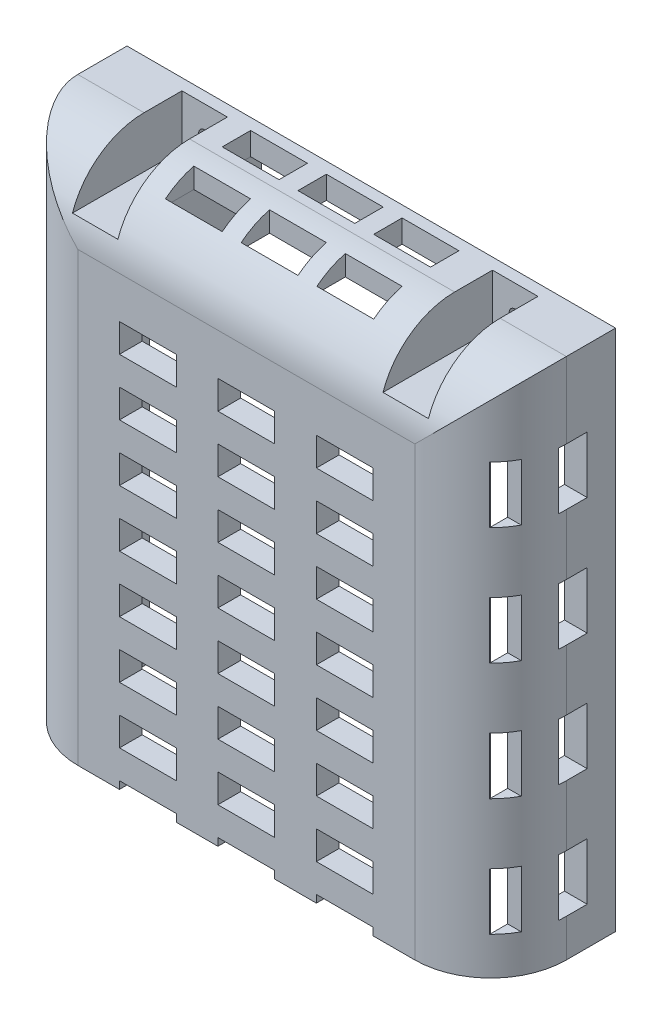
from build123d import *

# Parameters (mm, degrees)
ESBO_O1_W                = 129
ESBO_O1_H                = 276
ESBO_O1_R                = 1.6
RESSALTO_EXTRUS_O1_DEPTH = 3
ESBO_O4_W                = 70
ESBO_O4_H                = 6
ESBO_O4_W_2              = 6
ESBO_O4_H_2              = 100
RESSALTO_EXTRUS_O2_DEPTH = 24
RESSALTO_EXTRUS_O3_DEPTH = 6
RESSALTO_EXTRUS_O5_DEPTH = 27
RESSALTO_EXTRUS_O6_DEPTH = 94
FILETE1_R                = 20
ESBO_O9_R                = 5
ESBO_O9_W                = 15
ESBO_O9_H                = 7.5
CORTE_EXTRUS_O1_DEPTH    = 6
ESBO_O10_W               = 15
ESBO_O10_H               = 7.5
CORTE_EXTRUS_O2_DEPTH    = 6
ESBO_O11_W               = 15
ESBO_O11_H               = 7.5
CORTE_EXTRUS_O3_DEPTH    = 6
ESBO_O12_W               = 7.5
ESBO_O12_H               = 15
CORTE_EXTRUS_O4_DEPTH    = 6
CORTE_EXTRUS_O5_START    = -33
ESBO_O13_W               = 129
ESBO_O13_H               = 149.471958757
CORTE_EXTRUS_O5_DEPTH    = 33


with BuildPart() as part:
    # Esboço1 → Ressalto-extrusão1 (new body)
    with BuildSketch(Plane.XY):
        Rectangle(ESBO_O1_W, ESBO_O1_H)
        with Locations((-53.125, -128)):
            Circle(ESBO_O1_R, mode=Mode.SUBTRACT)
        with Locations((-41, 130.5)):
            Circle(ESBO_O1_R, mode=Mode.SUBTRACT)
        with Locations(Location((41, 130.5, 0), (0, 0, 180))):
            Circle(ESBO_O1_R, mode=Mode.SUBTRACT)
        with Locations(Location((53.125, -128, 0), (0, 0, 180))):
            Circle(ESBO_O1_R, mode=Mode.SUBTRACT)
        Polygon((-47.125, -132), (-47.125, -122), (-58.5, -122), (-58.5, 132), (-47, 132), (-47, 124.5), (-35, 124.5), (-35, 132), (35, 132), (35, 124.5), (47, 124.5), (47, 132), (58.5, 132), (58.5, -122), (47.125, -122), (47.125, -132), align=None, mode=Mode.SUBTRACT)
    extrude(amount=RESSALTO_EXTRUS_O1_DEPTH)

    # Esboço4 → Ressalto-extrusão2 (add)
    with BuildSketch(Plane.XY.offset(3)):
        Polygon((-64.5, 138), (-64.5, 72), (-58.5, 72), (-58.5, 132), (-47, 132), (-47, 138), align=None)
        with Locations((0, 135)):
            Rectangle(ESBO_O4_W, ESBO_O4_H)
        Polygon((47, 132), (47, 138), (64.5, 138), (64.5, 72), (58.5, 72), (58.5, 132), align=None)
        Polygon((-47.125, -132), (-47.125, -138), (47, -138), (47.125, -132), align=None)
        with Locations((-61.5, -72)):
            Rectangle(ESBO_O4_W_2, ESBO_O4_H_2)
        with Locations((61.5, -72)):
            Rectangle(ESBO_O4_W_2, ESBO_O4_H_2)
    extrude(amount=RESSALTO_EXTRUS_O2_DEPTH)

    # Esboço5 → Ressalto-extrusão3 (add)
    with BuildSketch(Plane.XY.offset(27)):
        Polygon((-35, 132), (-35, 138), (35, 138), (35, 132), (35, 124.5), (47, 124.5), (47, 132), (47, 138), (64.5, 138), (64.5, 72), (58.5, 72), (-64.5, 72), (-64.5, 138), (-47, 138), (-47, 124.5), (-35, 124.5), align=None)
        Polygon((-47.125, -138), (47, -138), (47.125, -122), (64.5, -122), (64.5, -22), (-64.5, -22), (-64.5, -122), (-47.125, -122), align=None)
    extrude(amount=RESSALTO_EXTRUS_O3_DEPTH)

    # Esboço7 → Ressalto-extrusão5 (add)
    with BuildSketch(Plane(origin=(0, 0, 27), x_dir=(-1, 0, 0), z_dir=(0, 0, -1))):
        Polygon((-47, 132), (-53, 132), (-53, 118.5), (-29, 118.5), (-29, 132), (-35, 132), (-35, 124.5), (-47, 124.5), align=None)
        Polygon((47.125, -132), (47.125, -122), (58.5, -122), (58.5, -116), (41.125, -116), (41.125, -132), align=None)
        Polygon((47, 124.5), (47, 132), (53, 132), (53, 118.5), (29, 118.5), (29, 132), (35, 132), (35, 124.5), align=None)
        Polygon((-41.125, -132), (-47.125, -132), (-47.125, -122), (-58.5, -122), (-58.5, -116), (-41.125, -116), align=None)
    extrude(amount=RESSALTO_EXTRUS_O5_DEPTH)

    # Esboço8 → Ressalto-extrusão6 (add)
    with BuildSketch(Plane(origin=(0, -22, 0), x_dir=(1, 0, 0), z_dir=(0, 1, 0))):
        Polygon((-58.5, -3), (-64.5, -3), (-64.5, -33), (64.5, -33), (64.5, -3), (58.5, -3), (58.5, -27), (-58.5, -27), align=None)
    extrude(amount=RESSALTO_EXTRUS_O6_DEPTH)

    # Filete1
    # the kernel refuses this fillet: 20 mm, written as the material it takes off along each edge
    with BuildSketch(Plane(origin=(-85, 138, 33), x_dir=(0, 0, -1), z_dir=(1, 0, 0))) as filete1_piece_1:
        with BuildLine():
            CenterArc((FILETE1_R, -FILETE1_R), FILETE1_R, 90, 90)
            Line((0, -FILETE1_R), (0, 0))
            Line((0, 0), (FILETE1_R, 0))
        make_face()
    extrude(amount=170, mode=Mode.SUBTRACT)
    with BuildSketch(Plane(origin=(-97.125, -138, 33), x_dir=(0, 0, -1), z_dir=(1, 0, 0))) as filete1_piece_2:
        with BuildLine():
            CenterArc((FILETE1_R, FILETE1_R), FILETE1_R, 180, 90)
            Line((0, FILETE1_R), (0, 0))
            Line((0, 0), (FILETE1_R, 0))
        make_face()
    extrude(amount=194.125, mode=Mode.SUBTRACT)
    with BuildSketch(Plane(origin=(64.5, -172, 33), x_dir=(0, 0, -1), z_dir=(0, 1, 0)), Plane(origin=(-64.5, -172, 33), x_dir=(1, 0, 0), z_dir=(0, 1, 0))) as filete1_piece_3:
        with BuildLine():
            CenterArc((FILETE1_R, FILETE1_R), FILETE1_R, 180, 90)
            Line((0, FILETE1_R), (0, 0))
            Line((0, 0), (FILETE1_R, 0))
        make_face()
    extrude(amount=360, mode=Mode.SUBTRACT)

    # Esboço9 → Corte-extrusão1 (cut)
    with BuildSketch(Plane.XY.offset(33)):
        with Locations((-26, -106.75)):
            Circle(ESBO_O9_R)
        with Locations((0, -106.75)):
            Rectangle(ESBO_O9_W, ESBO_O9_H)
        with Locations((26, -106.75)):
            Rectangle(ESBO_O9_W, ESBO_O9_H)
        with Locations((-26, -91.75)):
            Rectangle(ESBO_O9_W, ESBO_O9_H)
        with Locations((0, -91.75)):
            Rectangle(ESBO_O9_W, ESBO_O9_H)
        with Locations((26, -91.75)):
            Rectangle(ESBO_O9_W, ESBO_O9_H)
        with Locations((-26, -76.75)):
            Rectangle(ESBO_O9_W, ESBO_O9_H)
        with Locations((0, -76.75)):
            Rectangle(ESBO_O9_W, ESBO_O9_H)
        with Locations((26, -76.75)):
            Rectangle(ESBO_O9_W, ESBO_O9_H)
        with Locations((-26, -61.75)):
            Rectangle(ESBO_O9_W, ESBO_O9_H)
        with Locations((0, -61.75)):
            Rectangle(ESBO_O9_W, ESBO_O9_H)
        with Locations((26, -61.75)):
            Rectangle(ESBO_O9_W, ESBO_O9_H)
        with Locations((-26, -46.75)):
            Rectangle(ESBO_O9_W, ESBO_O9_H)
        with Locations((0, -46.75)):
            Rectangle(ESBO_O9_W, ESBO_O9_H)
        with Locations((26, -46.75)):
            Rectangle(ESBO_O9_W, ESBO_O9_H)
        with Locations((-26, -31.75)):
            Rectangle(ESBO_O9_W, ESBO_O9_H)
        with Locations((0, -31.75)):
            Rectangle(ESBO_O9_W, ESBO_O9_H)
        with Locations((26, -31.75)):
            Rectangle(ESBO_O9_W, ESBO_O9_H)
        with Locations((-26, -16.75)):
            Rectangle(ESBO_O9_W, ESBO_O9_H)
        with Locations((0, -16.75)):
            Rectangle(ESBO_O9_W, ESBO_O9_H)
        with Locations((26, -16.75)):
            Rectangle(ESBO_O9_W, ESBO_O9_H)
        with Locations((-26, -1.75)):
            Rectangle(ESBO_O9_W, ESBO_O9_H)
        with Locations((0, -1.75)):
            Rectangle(ESBO_O9_W, ESBO_O9_H)
        with Locations((26, -1.75)):
            Rectangle(ESBO_O9_W, ESBO_O9_H)
        with Locations((-26, 13.25)):
            Rectangle(ESBO_O9_W, ESBO_O9_H)
        with Locations((0, 13.25)):
            Rectangle(ESBO_O9_W, ESBO_O9_H)
        with Locations((26, 13.25)):
            Rectangle(ESBO_O9_W, ESBO_O9_H)
        with Locations((-26, 28.25)):
            Rectangle(ESBO_O9_W, ESBO_O9_H)
        with Locations((0, 28.25)):
            Rectangle(ESBO_O9_W, ESBO_O9_H)
        with Locations((26, 28.25)):
            Rectangle(ESBO_O9_W, ESBO_O9_H)
        with Locations((-26, 43.25)):
            Rectangle(ESBO_O9_W, ESBO_O9_H)
        with Locations((0, 43.25)):
            Rectangle(ESBO_O9_W, ESBO_O9_H)
        with Locations((26, 43.25)):
            Rectangle(ESBO_O9_W, ESBO_O9_H)
        with Locations((-26, 58.25)):
            Rectangle(ESBO_O9_W, ESBO_O9_H)
        with Locations((0, 58.25)):
            Rectangle(ESBO_O9_W, ESBO_O9_H)
        with Locations((26, 58.25)):
            Rectangle(ESBO_O9_W, ESBO_O9_H)
        with Locations((-26, 73.25)):
            Rectangle(ESBO_O9_W, ESBO_O9_H)
        with Locations((0, 73.25)):
            Rectangle(ESBO_O9_W, ESBO_O9_H)
        with Locations((26, 73.25)):
            Rectangle(ESBO_O9_W, ESBO_O9_H)
        with Locations((-26, 88.25)):
            Rectangle(ESBO_O9_W, ESBO_O9_H)
        with Locations((0, 88.25)):
            Rectangle(ESBO_O9_W, ESBO_O9_H)
        with Locations((26, 88.25)):
            Rectangle(ESBO_O9_W, ESBO_O9_H)
        with Locations((-26, 103.25)):
            Rectangle(ESBO_O9_W, ESBO_O9_H)
        with Locations((0, 103.25)):
            Rectangle(ESBO_O9_W, ESBO_O9_H)
        with Locations((26, 103.25)):
            Rectangle(ESBO_O9_W, ESBO_O9_H)
    extrude(amount=-CORTE_EXTRUS_O1_DEPTH, mode=Mode.SUBTRACT)

    # Esboço10 → Corte-extrusão2 (cut)
    with BuildSketch(Plane.XZ.offset(138)):
        with Locations((-32.125, 24.25)):
            Rectangle(ESBO_O10_W, ESBO_O10_H)
        with Locations((-2.125, 24.25)):
            Rectangle(ESBO_O10_W, ESBO_O10_H)
        with Locations((27.875, 24.25)):
            Rectangle(ESBO_O10_W, ESBO_O10_H)
        with Locations((-32.125, 11.75)):
            Rectangle(ESBO_O10_W, ESBO_O10_H)
        with Locations((-2.125, 11.75)):
            Rectangle(ESBO_O10_W, ESBO_O10_H)
        with Locations((27.875, 11.75)):
            Rectangle(ESBO_O10_W, ESBO_O10_H)
    extrude(amount=-CORTE_EXTRUS_O2_DEPTH, mode=Mode.SUBTRACT)

    # Esboço11 → Corte-extrusão3 (cut)
    with BuildSketch(Plane(origin=(0, 138, 0), x_dir=(1, 0, 0), z_dir=(0, 1, 0))):
        with Locations((-21.365084691, -21.75)):
            Rectangle(ESBO_O11_W, ESBO_O11_H)
        with Locations((-1.365084691, -21.75)):
            Rectangle(ESBO_O11_W, ESBO_O11_H)
        with Locations((18.634915309, -21.75)):
            Rectangle(ESBO_O11_W, ESBO_O11_H)
        with Locations((-1.365084691, -6.75)):
            Rectangle(ESBO_O11_W, ESBO_O11_H)
        with Locations((18.634915309, -6.75)):
            Rectangle(ESBO_O11_W, ESBO_O11_H)
        with Locations((-21.365084691, -6.75)):
            Rectangle(ESBO_O11_W, ESBO_O11_H)
    extrude(amount=-CORTE_EXTRUS_O3_DEPTH, mode=Mode.SUBTRACT)

    # Esboço12 → Corte-extrusão4 (cut)
    with BuildSketch(Plane.ZY.offset(64.5)):
        with Locations((11.25, 110.5)):
            Rectangle(ESBO_O12_W, ESBO_O12_H)
        with Locations((26.25, 110.5)):
            Rectangle(ESBO_O12_W, ESBO_O12_H)
        with Locations((26.25, 79.5)):
            Rectangle(ESBO_O12_W, ESBO_O12_H)
        with Locations((26.25, 48.5)):
            Rectangle(ESBO_O12_W, ESBO_O12_H)
        with Locations((26.25, 17.5)):
            Rectangle(ESBO_O12_W, ESBO_O12_H)
        with Locations((26.25, -13.5)):
            Rectangle(ESBO_O12_W, ESBO_O12_H)
        with Locations((26.25, -44.5)):
            Rectangle(ESBO_O12_W, ESBO_O12_H)
        with Locations((26.25, -75.5)):
            Rectangle(ESBO_O12_W, ESBO_O12_H)
        with Locations((26.25, -106.5)):
            Rectangle(ESBO_O12_W, ESBO_O12_H)
        with Locations((11.25, 79.5)):
            Rectangle(ESBO_O12_W, ESBO_O12_H)
        with Locations((11.25, 48.5)):
            Rectangle(ESBO_O12_W, ESBO_O12_H)
        with Locations((11.25, 17.5)):
            Rectangle(ESBO_O12_W, ESBO_O12_H)
        with Locations((11.25, -13.5)):
            Rectangle(ESBO_O12_W, ESBO_O12_H)
        with Locations((11.25, -44.5)):
            Rectangle(ESBO_O12_W, ESBO_O12_H)
        with Locations((11.25, -75.5)):
            Rectangle(ESBO_O12_W, ESBO_O12_H)
        with Locations((11.25, -106.5)):
            Rectangle(ESBO_O12_W, ESBO_O12_H)
    corte_extrus_o4 = extrude(amount=-CORTE_EXTRUS_O4_DEPTH, mode=Mode.SUBTRACT)

    # Espelhar2: Corte-extrusão4 across plane
    add(corte_extrus_o4.mirror(Plane(origin=(0, 0, 0), x_dir=(0, 0, 1), z_dir=(1, 0, 0))), mode=Mode.SUBTRACT)

    # Esboço13 → Corte-extrusão5 (cut)
    with BuildSketch(Plane.XY.offset(33).offset(CORTE_EXTRUS_O5_START)):
        with Locations((0, -74.735979379)):
            Rectangle(ESBO_O13_W, ESBO_O13_H)
    extrude(amount=CORTE_EXTRUS_O5_DEPTH, mode=Mode.SUBTRACT)


solid = part.part
